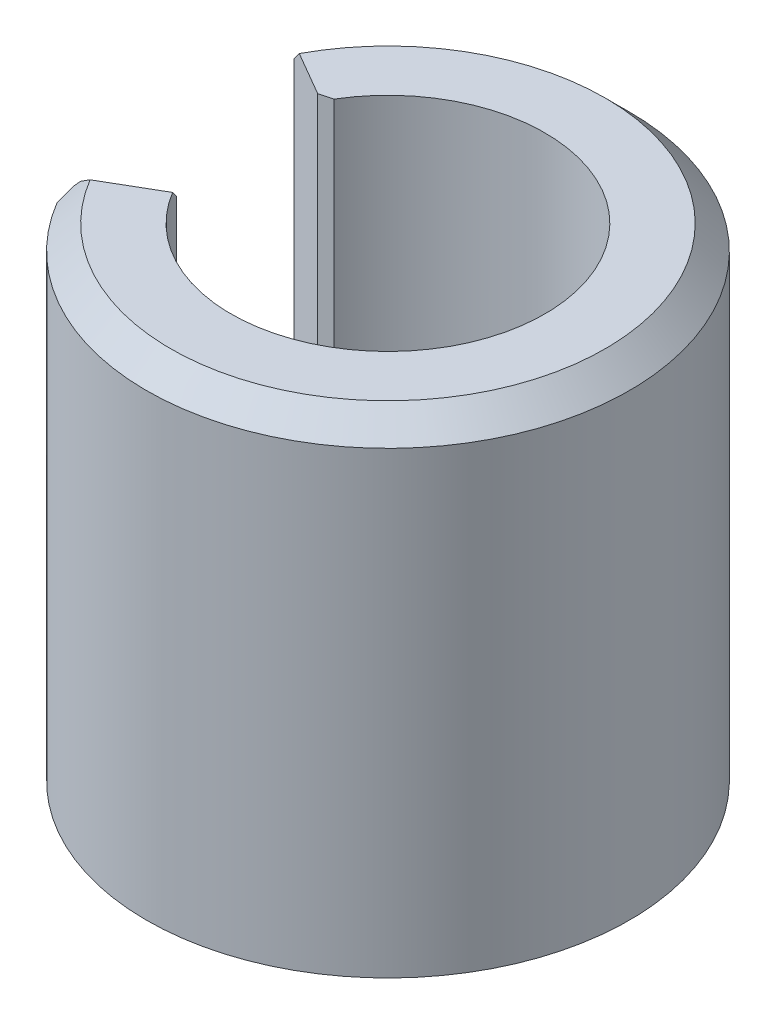
from build123d import *

# Parameters (mm, degrees)
BOSS_EXTRUDE1_DEPTH = 10
CHAMFER1_SIZE       = 0.2
CHAMFER1_SIZE_2     = 0.206341937
CHAMFER2_SIZE       = 0.5


with BuildPart() as part:
    # Sketch1 → Boss-Extrude1 (new body)
    with BuildSketch(Plane(origin=(0, 0, 0), x_dir=(1, 0, 0), z_dir=(0, 1, 0))):
        with BuildLine():
            ThreePointArc((5, 0), (1.227434059, 4.846999652), (-4.397362252, 2.379748983))
            Line((-4.397362252, 2.379748983), (-2.883140649, 1.5))
            ThreePointArc((-2.883140649, 1.5), (0.772105204, 3.156953207), (3.25, 0))
            ThreePointArc((3.25, 0), (0.772105204, -3.156953207), (-2.883140649, -1.5))
            Line((-2.883140649, -1.5), (-4.397362252, -2.379748983))
            ThreePointArc((-4.397362252, -2.379748983), (1.227434059, -4.846999652), (5, 0))
        make_face()
    extrude(amount=BOSS_EXTRUDE1_DEPTH)

    # Chamfer1
    # the kernel refuses this chamfer: 0.206341937, 0.2, 0.191297121 mm, written as the material it takes off along each edge
    with BuildSketch(Plane(origin=(-2.883140649, -0.514336598, -1.5), x_dir=(0.4881882615859918, 0, -0.8727383463843256), z_dir=(0, 1, 0))) as chamfer1_piece_1:
        with BuildLine():
            Line((0.196815803, 0), (CHAMFER1_SIZE * 0.0163116056584, CHAMFER1_SIZE * 0.99986695691))
            Line((CHAMFER1_SIZE * 0.0163116056584, CHAMFER1_SIZE * 0.99986695691), (0, 0))
            ThreePointArc((0, 0), (0.101193556, 0.001489012), (0.196815803, 0))
        make_face()
    extrude(amount=11.028673195, mode=Mode.SUBTRACT)
    with BuildSketch(Plane(origin=(-4.397362252, -0.531068819, -2.379748983), x_dir=(0.4931124519861111, 0, -0.8699655796042999), z_dir=(0, 1, 0))) as chamfer1_piece_2:
        with BuildLine():
            Line((0.196188757, 0), (-CHAMFER1_SIZE_2 * 0.010660935079, -CHAMFER1_SIZE_2 * 0.999943172174))
            Line((-CHAMFER1_SIZE_2 * 0.010660935079, -CHAMFER1_SIZE_2 * 0.999943172174), (0, 0))
            ThreePointArc((0, 0), (0.100953531, 0.000961526), (0.196188757, 0))
        make_face()
    extrude(amount=11.062137639, mode=Mode.SUBTRACT)
    with BuildSketch(Plane(origin=(-4.397362252, -0.520052168, 2.379748983), x_dir=(0.49362201920020077, 0, 0.8696765503109283), z_dir=(0, 1, 0))) as chamfer1_piece_3:
        with BuildLine():
            Line((0.202045895, 0), (-CHAMFER1_SIZE * 0.0100751366451, CHAMFER1_SIZE * 0.999949244523))
            Line((-CHAMFER1_SIZE * 0.0100751366451, CHAMFER1_SIZE * 0.999949244523), (0, 0))
            ThreePointArc((0, 0), (0.103969214, -0.0010198), (0.202045895, 0))
        make_face()
    extrude(amount=11.040104337, mode=Mode.SUBTRACT)
    # the kernel refuses this chamfer: 0.206341937, 0.2, 0.191297121 mm, written as the material it takes off along each edge
    with BuildSketch(Plane(origin=(-2.438414829, 10, 1.241618342), x_dir=(0.502359075260422, 0, 0.8646591001680913), z_dir=(-0.8646591001680916, 0, 0.5023590752604221))) as chamfer1_2_piece_1:
        Polygon((CHAMFER1_SIZE, 0), (0, -CHAMFER1_SIZE), (0, 0), align=None)
    extrude(amount=2.57990857, mode=Mode.SUBTRACT)

    # Chamfer2
    # the kernel refuses this chamfer: 0.5 mm, written as the material it takes off along each edge
    with BuildSketch(Plane(origin=(0, 10, 0), x_dir=(-0.9618869269385497, 0, -0.2734475082803154), z_dir=(-0.2734475082803154, 0, 0.9618869269385497))) as chamfer2_piece_1:
        Polygon((5, CHAMFER2_SIZE), (5 - CHAMFER2_SIZE, 0), (5, 0), align=None)
    revolve(axis=Axis((0, 10, 0), (0, -1, 0)), revolution_arc=328.193834559, mode=Mode.SUBTRACT)


solid = part.part
